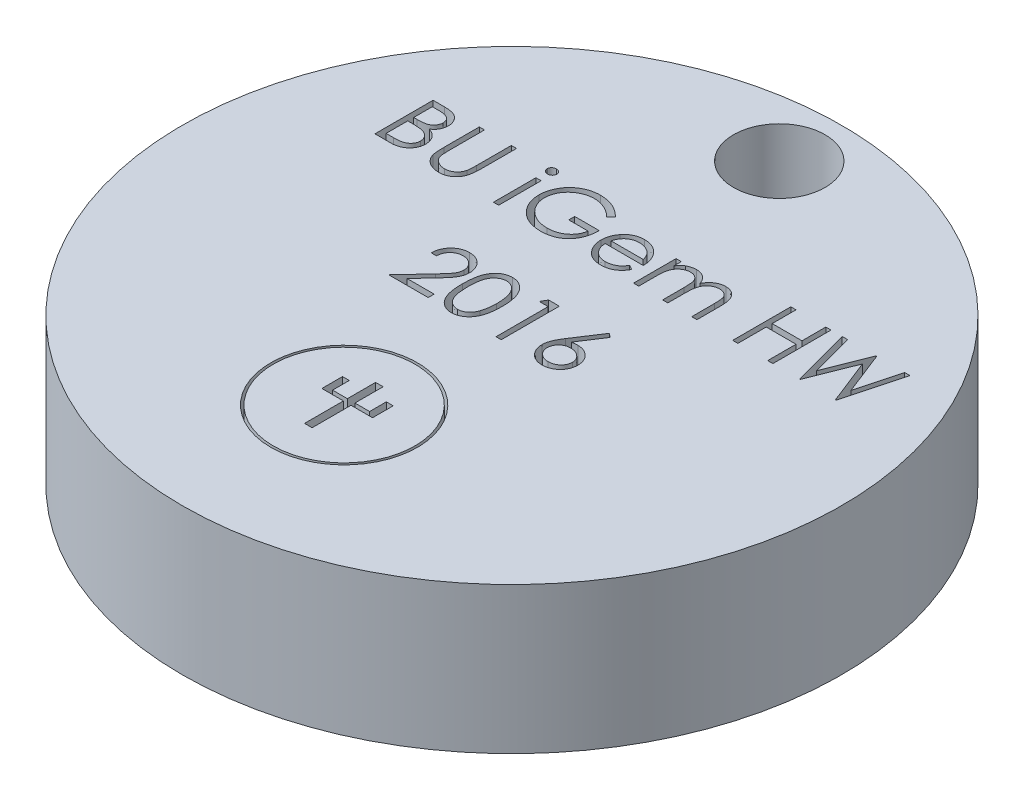
from build123d import *

# Parameters (mm, degrees)
SKETCH1_R           = 18
BOSS_EXTRUDE1_DEPTH = 8
SKETCH2_W           = 0.284935898
SKETCH2_H           = 2.320192307
CUT_EXTRUDE1_DEPTH  = 3
SKETCH3_R           = 4.004333154
SKETCH3_R_2         = 3.869636841
CUT_EXTRUDE2_DEPTH  = 3
SKETCH4_R           = 2.5
CUT_EXTRUDE3_DEPTH  = 27.683328263


with BuildPart() as part:
    # Sketch1 → Boss-Extrude1 (new body)
    with BuildSketch(Plane(origin=(0, 0, 0), x_dir=(1, 0, 0), z_dir=(0, 1, 0))):
        Circle(SKETCH1_R)
    extrude(amount=BOSS_EXTRUDE1_DEPTH)

    # Sketch2 → Cut-Extrude1 (cut)
    # profile 1 of 13: a face of its own
    with BuildSketch(Plane(origin=(0, 8, 0), x_dir=(1, 0, 0), z_dir=(0, 1, 0))):
        with BuildLine():
            Line((-12.333201326, 8.026096186), (-11.713720157, 8.026096186))
            add(Edge.make_bspline(
                [(-11.713720157, 8.026096186), (-11.683395751, 8.025936755), (-11.624619507, 8.025627738), (-11.539149013, 8.020835184), (-11.459094735, 8.014300426), (-11.384433456, 8.003931699), (-11.315199676, 7.991420587), (-11.251184748, 7.976269654), (-11.192592234, 7.958102654), (-11.122639966, 7.929213528), (-11.042883367, 7.886284654), (-10.956524825, 7.822849455), (-10.882679551, 7.745259292), (-10.819010534, 7.657735741), (-10.768390947, 7.561455433), (-10.731770227, 7.458713169), (-10.708585583, 7.35083416), (-10.706201218, 7.276772135), (-10.704996198, 7.239342379)],
                knots=[0, 0, 0, 0, 1.001505555, 1.941167018, 2.826882275, 3.653841531, 4.429895133, 5.150066043, 5.825578002, 6.45369114, 7.647487171, 8.808567382, 9.977351308, 11.170798116, 12.373658725, 13.556498008, 14.765093433, 16, 16, 16, 16], degree=3))
            add(Edge.make_bspline(
                [(-10.704996198, 7.239342379), (-10.705987904, 7.20427899), (-10.707936698, 7.135376122), (-10.726571915, 7.034597894), (-10.755746236, 6.938666432), (-10.796300283, 6.847931839), (-10.849007094, 6.764444204), (-10.911471426, 6.687530042), (-10.986833954, 6.620445868), (-11.043297465, 6.58294195), (-11.07197837, 6.563891658)],
                knots=[0, 0, 0, 0, 1.044552857, 2.05264487, 3.044412934, 4.028983338, 5.005914585, 5.980388656, 6.974128949, 8, 8, 8, 8], degree=3))
            add(Edge.make_bspline(
                [(-11.07197837, 6.563891658), (-11.035909982, 6.550044124), (-10.966902221, 6.523550359), (-10.871937053, 6.476709617), (-10.790117443, 6.42576256), (-10.720814318, 6.37012581), (-10.661543731, 6.310155674), (-10.609788562, 6.244972821), (-10.565627602, 6.173726948), (-10.527788021, 6.097160883), (-10.498261649, 6.016056444), (-10.476149222, 5.931174383), (-10.46347875, 5.842819072), (-10.461675676, 5.782688764), (-10.460765429, 5.752333165)],
                knots=[0, 0, 0, 0, 1.27268992, 2.434971085, 3.483601985, 4.442670788, 5.356604649, 6.2567628, 7.179492994, 8.113709626, 9.066344395, 10.018646069, 10.999752585, 12, 12, 12, 12], degree=3))
            add(Edge.make_bspline(
                [(-10.460765429, 5.752333165), (-10.461651568, 5.721338931), (-10.463395071, 5.660356907), (-10.476258331, 5.570771892), (-10.498038021, 5.485160333), (-10.528038275, 5.402968489), (-10.567192661, 5.324355367), (-10.614843028, 5.249231906), (-10.671658804, 5.178352906), (-10.735215835, 5.110930762), (-10.807117924, 5.050308412), (-10.88469293, 4.996319164), (-10.968917806, 4.951918094), (-11.058409258, 4.914619988), (-11.154171173, 4.886129173), (-11.255773538, 4.866196909), (-11.363128727, 4.852766626), (-11.436797572, 4.851662447), (-11.474577528, 4.851096186)],
                knots=[0, 0, 0, 0, 0.978564426, 1.925352924, 2.850884081, 3.763762016, 4.682927383, 5.618979971, 6.567305752, 7.547517671, 8.540179244, 9.531824382, 10.526200242, 11.540722885, 12.589160233, 13.674978461, 14.80764778, 16, 16, 16, 16], degree=3))
            Line((-11.474577528, 4.851096186), (-12.333201326, 4.851096186))
            Line((-12.333201326, 4.851096186), (-12.333201326, 8.026096186))
        make_face()
        with BuildLine():
            Line((-12.048265429, 7.70045516), (-12.048265429, 6.682826955))
            Line((-12.048265429, 6.682826955), (-11.856824123, 6.682826955))
            add(Edge.make_bspline(
                [(-11.856824123, 6.682826955), (-11.828839859, 6.683189742), (-11.774768557, 6.683890721), (-11.696464079, 6.685898697), (-11.623779241, 6.691521208), (-11.556839507, 6.697142103), (-11.49575029, 6.706281193), (-11.44064693, 6.717159762), (-11.390664631, 6.728664969), (-11.333025186, 6.748231575), (-11.267644726, 6.77714918), (-11.197946124, 6.822027203), (-11.136501284, 6.875480009), (-11.084615264, 6.937157524), (-11.042150573, 7.00507185), (-11.012655988, 7.078139377), (-10.992655952, 7.154539068), (-10.990849348, 7.206988483), (-10.989932096, 7.233618221)],
                knots=[0, 0, 0, 0, 1.156816544, 2.235205308, 3.236616184, 4.169592532, 5.011045266, 5.787822928, 6.49130361, 7.128639758, 8.301311294, 9.436451833, 10.541879658, 11.654887649, 12.756523258, 13.837046038, 14.901820046, 16, 16, 16, 16], degree=3))
            add(Edge.make_bspline(
                [(-10.989932096, 7.233618221), (-10.990409416, 7.251240171), (-10.991345733, 7.28580755), (-10.999014086, 7.336198749), (-11.012047528, 7.383591296), (-11.028788209, 7.428634668), (-11.052182233, 7.469920418), (-11.079726232, 7.508876031), (-11.113005394, 7.544174881), (-11.150885242, 7.577167212), (-11.194435921, 7.606417605), (-11.24363145, 7.632036012), (-11.299137415, 7.652665145), (-11.360018362, 7.67073194), (-11.42721142, 7.683421321), (-11.499941193, 7.693992608), (-11.578803402, 7.699374453), (-11.633363603, 7.700086889), (-11.661566711, 7.70045516)],
                knots=[0, 0, 0, 0, 0.91205012, 1.789085906, 2.630437955, 3.453916878, 4.269457761, 5.079663411, 5.91843418, 6.774407191, 7.675494373, 8.627863946, 9.638891023, 10.736472738, 11.911756761, 13.175263542, 14.539845004, 16, 16, 16, 16], degree=3))
            Line((-11.661566711, 7.70045516), (-12.048265429, 7.70045516))
        make_face(mode=Mode.SUBTRACT)
        with BuildLine():
            Line((-12.048265429, 6.357185929), (-12.048265429, 5.176737211))
            Line((-12.048265429, 5.176737211), (-11.642486182, 5.176737211))
            add(Edge.make_bspline(
                [(-11.642486182, 5.176737211), (-11.613440442, 5.177085325), (-11.557458608, 5.177756268), (-11.476631063, 5.179946614), (-11.40171639, 5.184928893), (-11.333056439, 5.192771914), (-11.269909814, 5.201279507), (-11.21303404, 5.21271974), (-11.161968072, 5.225827011), (-11.10275495, 5.246087296), (-11.036076768, 5.277561952), (-10.964221205, 5.325018429), (-10.900334564, 5.381554572), (-10.846082651, 5.446987616), (-10.801620868, 5.518136034), (-10.769276277, 5.593560744), (-10.749327428, 5.672015473), (-10.74691246, 5.725506705), (-10.745701326, 5.752333165)],
                knots=[0, 0, 0, 0, 1.160039823, 2.235823828, 3.228722157, 4.157150951, 4.99529583, 5.772374946, 6.472645482, 7.099169577, 8.269452708, 9.405989375, 10.527446681, 11.663510218, 12.788923519, 13.866172445, 14.929861265, 16, 16, 16, 16], degree=3))
            add(Edge.make_bspline(
                [(-10.745701326, 5.752333165), (-10.745951792, 5.769109266), (-10.746448685, 5.80239087), (-10.753942242, 5.85130022), (-10.764840539, 5.898676548), (-10.778929768, 5.944648498), (-10.799448856, 5.988384918), (-10.823403365, 6.030750812), (-10.851489779, 6.071802182), (-10.895254129, 6.123701869), (-10.958910144, 6.183498017), (-11.049358433, 6.242042751), (-11.152203303, 6.289257547), (-11.226795386, 6.30930493), (-11.265327729, 6.319660889)],
                knots=[0, 0, 0, 0, 0.723448775, 1.435228256, 2.130040452, 2.821711965, 3.505591119, 4.210454504, 4.921174351, 5.648778258, 7.137944449, 8.670945889, 10.280296675, 12, 12, 12, 12], degree=3))
            add(Edge.make_bspline(
                [(-11.265327729, 6.319660889), (-11.280775551, 6.322795144), (-11.314269617, 6.329590855), (-11.368886494, 6.336764271), (-11.431239746, 6.343155147), (-11.501473356, 6.347882411), (-11.579676184, 6.352768776), (-11.666015246, 6.354669078), (-11.760137952, 6.356936264), (-11.825445319, 6.357100578), (-11.859368193, 6.357185929)],
                knots=[0, 0, 0, 0, 0.634451884, 1.375622551, 2.216452059, 3.157844607, 4.20941857, 5.370758133, 6.634282058, 8, 8, 8, 8], degree=3))
            Line((-11.859368193, 6.357185929), (-12.048265429, 6.357185929))
        make_face(mode=Mode.SUBTRACT)
    # profile 2 of 13: a face of its own
    with BuildSketch(Plane(origin=(0, 8, 0), x_dir=(1, 0, 0), z_dir=(0, 1, 0))):
        with BuildLine():
            Line((-9.809483378, 8.026096186), (-9.52454748, 8.026096186))
            Line((-9.52454748, 8.026096186), (-9.52454748, 6.12376746))
            add(Edge.make_bspline(
                [(-9.52454748, 6.12376746), (-9.524589884, 6.096842792), (-9.524670352, 6.045748596), (-9.524132857, 5.973024495), (-9.522627573, 5.908370192), (-9.521678556, 5.85153647), (-9.519567332, 5.802784121), (-9.517845533, 5.761849017), (-9.515631599, 5.728924991), (-9.512970843, 5.709710865), (-9.511827128, 5.701451754)],
                knots=[0, 0, 0, 0, 1.528628734, 2.90083645, 4.128790002, 5.200304208, 6.127813768, 6.898992206, 7.526736466, 8, 8, 8, 8], degree=3))
            add(Edge.make_bspline(
                [(-9.511827128, 5.701451754), (-9.507130433, 5.671655048), (-9.498001685, 5.613740572), (-9.474736757, 5.531273773), (-9.442245167, 5.456950236), (-9.403743264, 5.388450708), (-9.353004395, 5.327681788), (-9.292222616, 5.271700503), (-9.218582783, 5.222740366), (-9.13670352, 5.17797213), (-9.048451911, 5.141990234), (-8.958271691, 5.114781968), (-8.867518417, 5.098200394), (-8.806761468, 5.096280391), (-8.776590749, 5.095326955)],
                knots=[0, 0, 0, 0, 1.035780045, 2.013197591, 2.933192213, 3.817615948, 4.702609284, 5.640816605, 6.646850145, 7.73207398, 8.84249596, 9.914020372, 10.964143139, 12, 12, 12, 12], degree=3))
            add(Edge.make_bspline(
                [(-8.776590749, 5.095326955), (-8.750688428, 5.09630109), (-8.69903339, 5.098243735), (-8.62228327, 5.110273748), (-8.5475346, 5.131954975), (-8.474418269, 5.159931042), (-8.405882733, 5.196894928), (-8.341889754, 5.239594904), (-8.284772471, 5.289679056), (-8.232649858, 5.345105797), (-8.187261024, 5.407644044), (-8.147917202, 5.475932069), (-8.115690109, 5.550997548), (-8.099775626, 5.603751917), (-8.091599764, 5.630853798)],
                knots=[0, 0, 0, 0, 0.994687771, 1.983630487, 2.973142513, 3.978332533, 4.983357753, 5.956394766, 6.925816176, 7.893390482, 8.871859704, 9.88551698, 10.913711441, 12, 12, 12, 12], degree=3))
            add(Edge.make_bspline(
                [(-8.091599764, 5.630853798), (-8.088878222, 5.642055719), (-8.082813529, 5.667018113), (-8.077146567, 5.70921957), (-8.071244219, 5.759012064), (-8.067148859, 5.816753351), (-8.063156323, 5.882249948), (-8.06076775, 5.955843053), (-8.059663727, 6.037265439), (-8.059334724, 6.094086293), (-8.059162865, 6.12376746)],
                knots=[0, 0, 0, 0, 0.558680831, 1.244966039, 2.062412453, 2.990489873, 4.051219941, 5.244515665, 6.560634259, 8, 8, 8, 8], degree=3))
            Line((-8.059162865, 6.12376746), (-8.059162865, 8.026096186))
            Line((-8.059162865, 8.026096186), (-7.774226967, 8.026096186))
            Line((-7.774226967, 8.026096186), (-7.774226967, 6.108503036))
            add(Edge.make_bspline(
                [(-7.774226967, 6.108503036), (-7.774457491, 6.073942364), (-7.774907372, 6.006495111), (-7.778808609, 5.907660664), (-7.785028887, 5.813904745), (-7.793817367, 5.725214752), (-7.805462363, 5.64190805), (-7.818412027, 5.563254439), (-7.834903461, 5.48981851), (-7.854165189, 5.421027674), (-7.876184765, 5.355545101), (-7.904706378, 5.293398001), (-7.93684146, 5.232697081), (-7.974954752, 5.174360439), (-8.017782221, 5.11812978), (-8.066270531, 5.064346119), (-8.11881602, 5.012149985), (-8.176292192, 4.962880275), (-8.237751597, 4.917696689), (-8.303011416, 4.877965854), (-8.371570342, 4.844380144), (-8.443250164, 4.816734127), (-8.518081469, 4.795947312), (-8.596066146, 4.780457706), (-8.6773817, 4.771656336), (-8.732685352, 4.7703483), (-8.760690309, 4.769685929)],
                knots=[0, 0, 0, 0, 1.316592851, 2.569410997, 3.76748051, 4.895814652, 5.963796859, 6.97159953, 7.931736103, 8.829262218, 9.692595152, 10.560224239, 11.431080259, 12.30701507, 13.211635791, 14.121146779, 15.063487852, 16.031507147, 17.00238618, 17.966455255, 18.938106653, 19.907068911, 20.888905087, 21.893141452, 22.933117798, 24, 24, 24, 24], degree=3))
            add(Edge.make_bspline(
                [(-8.760690309, 4.769685929), (-8.791232995, 4.770397823), (-8.851157635, 4.771794557), (-8.939457168, 4.779798052), (-9.024106474, 4.79487331), (-9.105999591, 4.814068401), (-9.184021585, 4.84054222), (-9.259217781, 4.871474091), (-9.330300299, 4.909462748), (-9.398422309, 4.951729612), (-9.461763337, 4.999286248), (-9.519908839, 5.051120549), (-9.572954807, 5.106402177), (-9.620007125, 5.165729651), (-9.661845356, 5.228641557), (-9.697886335, 5.295315867), (-9.728831921, 5.365726768), (-9.744803592, 5.414670029), (-9.752877809, 5.439412492)],
                knots=[0, 0, 0, 0, 1.13879206, 2.234305948, 3.301075583, 4.341971843, 5.366689343, 6.369221514, 7.369726634, 8.367512178, 9.355451585, 10.318319045, 11.268648973, 12.207971039, 13.137398894, 14.081662264, 15.030215811, 16, 16, 16, 16], degree=3))
            add(Edge.make_bspline(
                [(-9.752877809, 5.439412492), (-9.757574231, 5.456314898), (-9.767760875, 5.492976595), (-9.778669538, 5.553652196), (-9.787839919, 5.623515728), (-9.796462818, 5.702571975), (-9.801550944, 5.790882211), (-9.806011764, 5.888408156), (-9.809514804, 5.995267735), (-9.809494146, 6.069702903), (-9.809483378, 6.108503036)],
                knots=[0, 0, 0, 0, 0.625038921, 1.35572334, 2.194682327, 3.136881307, 4.189498639, 5.346923369, 6.617055217, 8, 8, 8, 8], degree=3))
            Line((-9.809483378, 6.108503036), (-9.809483378, 8.026096186))
        make_face()
    # profile 3 of 13: a face of its own
    with BuildSketch(Plane(origin=(0, 8, 0), x_dir=(1, 0, 0), z_dir=(0, 1, 0))):
        with BuildLine():
            add(Edge.make_bspline(
                [(-5.719890028, 8.14821157), (-5.70220862, 8.147391375), (-5.667585028, 8.145785275), (-5.617516849, 8.132031649), (-5.57192656, 8.108718363), (-5.531488188, 8.077440367), (-5.496788262, 8.040656229), (-5.472494332, 7.997783779), (-5.45688023, 7.951466299), (-5.454994683, 7.919158326), (-5.45403466, 7.902708766)],
                knots=[0, 0, 0, 0, 1.055194115, 2.066272739, 3.074728998, 4.095836921, 5.109056067, 6.073838105, 7.019297344, 8, 8, 8, 8], degree=3))
            add(Edge.make_bspline(
                [(-5.45403466, 7.902708766), (-5.455016333, 7.886686216), (-5.456956986, 7.855011532), (-5.472482272, 7.809497025), (-5.496995302, 7.767220282), (-5.531465937, 7.730507566), (-5.571932456, 7.699246861), (-5.617515283, 7.675928991), (-5.66758544, 7.66217658), (-5.70220876, 7.660570313), (-5.719890028, 7.659750032)],
                knots=[0, 0, 0, 0, 0.96129708, 1.900370562, 2.859976407, 3.87933698, 4.906634145, 5.921202961, 6.938410037, 8, 8, 8, 8], degree=3))
            add(Edge.make_bspline(
                [(-5.719890028, 7.659750032), (-5.737369107, 7.660538992), (-5.771389849, 7.662074601), (-5.820708341, 7.676198831), (-5.865909899, 7.69925484), (-5.906427138, 7.73030288), (-5.940200242, 7.767445751), (-5.964782294, 7.809471224), (-5.980271724, 7.8550181), (-5.982217209, 7.886688423), (-5.983201326, 7.902708766)],
                knots=[0, 0, 0, 0, 1.054934014, 2.053291228, 3.073705704, 4.106921865, 5.123545215, 6.088680038, 7.033164197, 8, 8, 8, 8], degree=3))
            add(Edge.make_bspline(
                [(-5.983201326, 7.902708766), (-5.982238769, 7.919156036), (-5.980348246, 7.951459514), (-5.964770684, 7.997810008), (-5.940405001, 8.040428942), (-5.906404776, 8.07764493), (-5.865915851, 8.108710432), (-5.820706803, 8.131761822), (-5.771390255, 8.145887252), (-5.737369244, 8.147422695), (-5.719890028, 8.14821157)],
                knots=[0, 0, 0, 0, 0.98631895, 1.937192651, 2.907499808, 3.917963147, 4.944918757, 5.95915025, 6.951458133, 8, 8, 8, 8], degree=3))
        make_face()
    # profile 4 of 13: a face of its own
    with BuildSketch(Plane(origin=(0, 8, 0), x_dir=(1, 0, 0), z_dir=(0, 1, 0))):
        with Locations((-5.718617993, 6.01119234)):
            Rectangle(SKETCH2_W, SKETCH2_H)
    # profile 5 of 13: a face of its own
    with BuildSketch(Plane(origin=(0, 8, 0), x_dir=(1, 0, 0), z_dir=(0, 1, 0))):
        with BuildLine():
            Line((-1.831278249, 7.484209166), (-2.075509019, 7.25269875))
            add(Edge.make_bspline(
                [(-2.075509019, 7.25269875), (-2.11970401, 7.29427389), (-2.207040138, 7.376432787), (-2.349425501, 7.483032047), (-2.497982512, 7.57435058), (-2.651935991, 7.648651238), (-2.807473394, 7.707935528), (-2.962530212, 7.750143198), (-3.115515955, 7.777060428), (-3.217267646, 7.780279306), (-3.267406054, 7.781865416)],
                knots=[0, 0, 0, 0, 1.08915593, 2.152340314, 3.188132944, 4.216796309, 5.218260357, 6.173443236, 7.099959455, 8, 8, 8, 8], degree=3))
            add(Edge.make_bspline(
                [(-3.267406054, 7.781865416), (-3.298171532, 7.781490217), (-3.359622696, 7.78074079), (-3.450901174, 7.771175681), (-3.541222337, 7.757418983), (-3.630415684, 7.737514565), (-3.718654637, 7.712287776), (-3.805632303, 7.680732391), (-3.891510932, 7.643942991), (-3.975481592, 7.601432033), (-4.056889048, 7.554732458), (-4.133775606, 7.502981281), (-4.206631333, 7.447837165), (-4.274086861, 7.387919491), (-4.336530209, 7.323771006), (-4.395447661, 7.256585007), (-4.448767065, 7.184525915), (-4.496928336, 7.108919526), (-4.53989209, 7.031093754), (-4.577818511, 6.951797685), (-4.609656584, 6.871294332), (-4.634847447, 6.789482675), (-4.655630683, 6.70699564), (-4.670251655, 6.623262072), (-4.67849461, 6.538192315), (-4.679920439, 6.481226231), (-4.680637224, 6.452588573)],
                knots=[0, 0, 0, 0, 1.02818874, 2.053710826, 3.065248034, 4.081641283, 5.106893873, 6.131558223, 7.173050175, 8.228653731, 9.27666206, 10.308777013, 11.325269123, 12.329503258, 13.32196095, 14.316845687, 15.314881793, 16.315733098, 17.311955233, 18.285320748, 19.252783886, 20.203351036, 21.145449891, 22.095197417, 23.042428769, 24, 24, 24, 24], degree=3))
            add(Edge.make_bspline(
                [(-4.680637224, 6.452588573), (-4.679951679, 6.423314332), (-4.678582463, 6.364845788), (-4.669819173, 6.277584022), (-4.653555697, 6.191618264), (-4.631813562, 6.106666029), (-4.604616679, 6.022581825), (-4.570714332, 5.939730191), (-4.530559108, 5.858114194), (-4.484080236, 5.778469213), (-4.433111323, 5.700887613), (-4.376012957, 5.627808618), (-4.315360856, 5.558259084), (-4.24894539, 5.493783213), (-4.178896233, 5.432656393), (-4.103120526, 5.376562741), (-4.023108294, 5.324421781), (-3.938737466, 5.276890653), (-3.850923513, 5.234428624), (-3.760883459, 5.196669804), (-3.668329655, 5.165573548), (-3.5737485, 5.140229696), (-3.477252747, 5.119455855), (-3.378352583, 5.106091391), (-3.277775198, 5.09639328), (-3.209976581, 5.095684194), (-3.175819516, 5.095326955)],
                knots=[0, 0, 0, 0, 0.93586088, 1.869166235, 2.799637598, 3.729985548, 4.670839027, 5.622275134, 6.589130586, 7.576015415, 8.568469353, 9.55398029, 10.53834874, 11.515998671, 12.510579167, 13.508179873, 14.527009472, 15.561807829, 16.601455013, 17.643573243, 18.680854198, 19.719860599, 20.772568776, 21.833555941, 22.908541556, 24, 24, 24, 24], degree=3))
            add(Edge.make_bspline(
                [(-3.175819516, 5.095326955), (-3.134654872, 5.096187449), (-3.053821406, 5.097877169), (-2.934997991, 5.111031003), (-2.820876634, 5.13157488), (-2.711778006, 5.161661087), (-2.607575395, 5.200036563), (-2.507886798, 5.246296664), (-2.413497079, 5.302215724), (-2.324122486, 5.365329161), (-2.241792753, 5.435646188), (-2.167539369, 5.511523658), (-2.102546675, 5.592593261), (-2.045845984, 5.678377511), (-1.998938848, 5.769586467), (-1.960437169, 5.865773148), (-1.930924826, 5.96698082), (-1.918809956, 6.036913943), (-1.912688506, 6.072250032)],
                knots=[0, 0, 0, 0, 1.13008108, 2.219097802, 3.278683437, 4.311054135, 5.322181354, 6.324827112, 7.324222904, 8.330512327, 9.32562643, 10.293043162, 11.24128371, 12.174520618, 13.111833804, 14.052305215, 15.015860969, 16, 16, 16, 16], degree=3))
            Line((-1.912688506, 6.072250032), (-2.971021839, 6.072250032))
            Line((-2.971021839, 6.072250032), (-2.971021839, 6.397891057))
            Line((-2.971021839, 6.397891057), (-1.627752608, 6.397891057))
            add(Edge.make_bspline(
                [(-1.627752608, 6.397891057), (-1.629300057, 6.337196407), (-1.632328692, 6.218406012), (-1.653572994, 6.045168695), (-1.687877973, 5.881545801), (-1.734741256, 5.727365015), (-1.795406689, 5.582844827), (-1.869223197, 5.447838506), (-1.957372193, 5.323218231), (-2.056713807, 5.207966635), (-2.168201626, 5.10516085), (-2.28882316, 5.014804034), (-2.418777696, 4.938692376), (-2.557942307, 4.876770204), (-2.705861414, 4.82844308), (-2.862877302, 4.794178864), (-3.028777039, 4.773650254), (-3.14247531, 4.77102736), (-3.200624203, 4.769685929)],
                knots=[0, 0, 0, 0, 1.140356446, 2.231883559, 3.274166699, 4.278491846, 5.25512956, 6.21435461, 7.1637429, 8.11826594, 9.068280886, 10.0076534, 10.945064095, 11.891975133, 12.864533718, 13.863980011, 14.907571808, 16, 16, 16, 16], degree=3))
            add(Edge.make_bspline(
                [(-3.200624203, 4.769685929), (-3.23646554, 4.770202203), (-3.307156208, 4.771220463), (-3.411560122, 4.778457056), (-3.513085392, 4.789597293), (-3.611717228, 4.80642037), (-3.707818439, 4.827025806), (-3.800909062, 4.853411615), (-3.891343714, 4.883953935), (-3.979262172, 4.918693582), (-4.06386644, 4.958945013), (-4.145533352, 5.003675901), (-4.224714337, 5.052655592), (-4.300870037, 5.106731145), (-4.374397251, 5.165498091), (-4.444821874, 5.229074218), (-4.512538164, 5.297265162), (-4.554956584, 5.345687549), (-4.576330333, 5.37008657)],
                knots=[0, 0, 0, 0, 1.107784379, 2.184907829, 3.233506516, 4.263428166, 5.276301166, 6.270063455, 7.25232949, 8.225834625, 9.190232166, 10.146266622, 11.1027726, 12.066435141, 13.031522626, 14.010570082, 14.99756817, 16, 16, 16, 16], degree=3))
            add(Edge.make_bspline(
                [(-4.576330333, 5.37008657), (-4.607341857, 5.408794948), (-4.668850145, 5.485569185), (-4.748023902, 5.608577706), (-4.815516603, 5.735942251), (-4.870278842, 5.868017378), (-4.91303982, 6.00467955), (-4.943706921, 6.145754135), (-4.961674961, 6.2914228), (-4.964263528, 6.389997719), (-4.965573121, 6.439868221)],
                knots=[0, 0, 0, 0, 1.023165419, 2.029347347, 3.013907458, 3.994755782, 4.975994455, 5.96558838, 6.970761222, 8, 8, 8, 8], degree=3))
            add(Edge.make_bspline(
                [(-4.965573121, 6.439868221), (-4.965090305, 6.477211893), (-4.96413081, 6.551424622), (-4.952496234, 6.661603751), (-4.935803519, 6.769826521), (-4.911267977, 6.876004469), (-4.880337794, 6.980208506), (-4.841735703, 7.082487016), (-4.796791404, 7.182900356), (-4.744553133, 7.280757365), (-4.686419373, 7.374759511), (-4.623327388, 7.464528376), (-4.554381265, 7.54842917), (-4.480706932, 7.627524451), (-4.401425377, 7.700820548), (-4.317279328, 7.768996063), (-4.228203939, 7.832142446), (-4.133918975, 7.889265081), (-4.035831719, 7.940576366), (-3.934177289, 7.985560865), (-3.828986717, 8.022738587), (-3.721048076, 8.054283373), (-3.609544344, 8.077610679), (-3.495284678, 8.094527755), (-3.377673505, 8.106103442), (-3.298175107, 8.107034402), (-3.25786579, 8.107506442)],
                knots=[0, 0, 0, 0, 1.008945113, 2.00506715, 2.99143336, 3.967273523, 4.948097931, 5.927297278, 6.919902385, 7.919676788, 8.923139349, 9.905703106, 10.883022732, 11.856032218, 12.825136022, 13.798837087, 14.781400844, 15.773989409, 16.776158564, 17.77167057, 18.775803737, 19.789618931, 20.80898985, 21.851988756, 22.910860228, 24, 24, 24, 24], degree=3))
            add(Edge.make_bspline(
                [(-3.25786579, 8.107506442), (-3.224992526, 8.10698076), (-3.159808706, 8.105938395), (-3.062811792, 8.098713321), (-2.967314129, 8.087261658), (-2.873174118, 8.071634501), (-2.780712343, 8.050349582), (-2.689665403, 8.024878567), (-2.599901317, 7.995222413), (-2.511701405, 7.95985396), (-2.42447262, 7.9197096), (-2.33772995, 7.87452171), (-2.251769777, 7.823517598), (-2.166443029, 7.76654582), (-2.081211644, 7.704584862), (-1.997423718, 7.635862601), (-1.913056762, 7.563089101), (-1.858807973, 7.51076312), (-1.831278249, 7.484209166)],
                knots=[0, 0, 0, 0, 0.985871117, 1.954866573, 2.915460327, 3.869826059, 4.81536089, 5.759505086, 6.70452669, 7.649098992, 8.607881297, 9.583363685, 10.581137262, 11.603961102, 12.659522466, 13.73993555, 14.853081303, 16, 16, 16, 16], degree=3))
        make_face()
    # profile 6 of 13: a face of its own
    with BuildSketch(Plane(origin=(0, 8, 0), x_dir=(1, 0, 0), z_dir=(0, 1, 0))):
        with BuildLine():
            Line((0.846355965, 5.583788493), (1.099490981, 5.450860809))
            add(Edge.make_bspline(
                [(1.099490981, 5.450860809), (1.079319213, 5.415080073), (1.040072939, 5.345464929), (0.972580832, 5.24982317), (0.901830881, 5.163782742), (0.824629424, 5.08964227), (0.743286215, 5.025007085), (0.657350164, 4.968457773), (0.56637388, 4.920271687), (0.470353058, 4.879674751), (0.368481322, 4.848460424), (0.260511804, 4.826413023), (0.146237661, 4.812784773), (0.067909341, 4.811201681), (0.027801278, 4.810391057)],
                knots=[0, 0, 0, 0, 1.120438281, 2.179929193, 3.190490725, 4.156257408, 5.095198341, 6.022838206, 6.959905092, 7.901321166, 8.864066838, 9.862729781, 10.905609505, 12, 12, 12, 12], degree=3))
            add(Edge.make_bspline(
                [(0.027801278, 4.810391057), (-0.016777516, 4.811431709), (-0.103737829, 4.81346172), (-0.230320313, 4.830962741), (-0.349500214, 4.859512666), (-0.461270831, 4.899395693), (-0.565358446, 4.95149048), (-0.661969936, 5.014953724), (-0.751613363, 5.089459412), (-0.831463895, 5.175652901), (-0.903349417, 5.267892962), (-0.966782125, 5.364010086), (-1.019811367, 5.463762439), (-1.062948377, 5.566514986), (-1.097787076, 5.671620089), (-1.1220683, 5.780034064), (-1.136065286, 5.891463486), (-1.138210176, 5.966844641), (-1.13929107, 6.004832163)],
                knots=[0, 0, 0, 0, 1.145258523, 2.234067595, 3.276747158, 4.290159414, 5.277019952, 6.260822364, 7.254936242, 8.264827045, 9.274100331, 10.257902744, 11.220704747, 12.172965371, 13.118907548, 14.062713208, 15.023725156, 16, 16, 16, 16], degree=3))
            add(Edge.make_bspline(
                [(-1.13929107, 6.004832163), (-1.138330278, 6.040478188), (-1.136426114, 6.111123902), (-1.124423899, 6.215686217), (-1.103152948, 6.317312027), (-1.073964425, 6.416085777), (-1.036271509, 6.511842084), (-0.990159425, 6.604639227), (-0.935556339, 6.694378461), (-0.893398985, 6.750987018), (-0.872163666, 6.779501634)],
                knots=[0, 0, 0, 0, 1.024358464, 2.0301432, 3.019427413, 4.004406732, 4.986367066, 5.972626655, 6.978780325, 8, 8, 8, 8], degree=3))
            add(Edge.make_bspline(
                [(-0.872163666, 6.779501634), (-0.843400268, 6.813854109), (-0.786784624, 6.88147086), (-0.69102993, 6.970314913), (-0.587343323, 7.044740337), (-0.477024205, 7.106432525), (-0.358790404, 7.153307905), (-0.234231261, 7.188239783), (-0.10192848, 7.207814122), (-0.011481601, 7.210578942), (0.034797472, 7.211993621)],
                knots=[0, 0, 0, 0, 1.030682036, 2.02871468, 2.997146059, 3.962720338, 4.930598197, 5.918074684, 6.934738563, 8, 8, 8, 8], degree=3))
            add(Edge.make_bspline(
                [(0.034797472, 7.211993621), (0.082374942, 7.210765306), (0.175711094, 7.20835563), (0.311811661, 7.186016028), (0.440590311, 7.150589782), (0.561995511, 7.100557415), (0.676039571, 7.036005535), (0.781981201, 6.956048294), (0.881632216, 6.863140457), (0.939606427, 6.791690974), (0.969107368, 6.755332964)],
                knots=[0, 0, 0, 0, 1.056321875, 2.072262726, 3.055038591, 4.01806755, 4.982017516, 5.957941055, 6.960871419, 8, 8, 8, 8], degree=3))
            add(Edge.make_bspline(
                [(0.969107368, 6.755332964), (0.989179662, 6.727934001), (1.029190642, 6.673318451), (1.079307655, 6.584263187), (1.122811863, 6.491090005), (1.157585335, 6.392292807), (1.185742596, 6.289042188), (1.206114139, 6.180600022), (1.218060865, 6.066998602), (1.220409183, 5.989595227), (1.221606366, 5.950134647)],
                knots=[0, 0, 0, 0, 0.94817472, 1.890038105, 2.849395472, 3.817997239, 4.812318967, 5.836947057, 6.897266129, 8, 8, 8, 8], degree=3))
            Line((1.221606366, 5.950134647), (-0.854355173, 5.950134647))
            add(Edge.make_bspline(
                [(-0.854355173, 5.950134647), (-0.85295853, 5.919563512), (-0.850212088, 5.859446607), (-0.837407636, 5.771480254), (-0.81722482, 5.687684436), (-0.788859313, 5.608687677), (-0.754508675, 5.533458204), (-0.712430203, 5.46255407), (-0.662229322, 5.396298234), (-0.606235295, 5.334098045), (-0.543908144, 5.278707211), (-0.478337366, 5.229130243), (-0.408583918, 5.187578023), (-0.335197799, 5.153850551), (-0.25829768, 5.127446965), (-0.177859332, 5.109424013), (-0.09404104, 5.097352566), (-0.036903982, 5.096010298), (-0.007815709, 5.095326955)],
                knots=[0, 0, 0, 0, 1.094153842, 2.151609401, 3.174256925, 4.172055639, 5.149267565, 6.128595816, 7.11444997, 8.118368179, 9.117203808, 10.09244225, 11.054858984, 12.015122123, 12.976791628, 13.957293641, 14.960065497, 16, 16, 16, 16], degree=3))
            add(Edge.make_bspline(
                [(-0.007815709, 5.095326955), (0.02062426, 5.095878549), (0.077054616, 5.096973018), (0.161093108, 5.107615537), (0.243769679, 5.124824287), (0.324742142, 5.148310207), (0.402367124, 5.176954922), (0.474254159, 5.211519658), (0.540366926, 5.249755499), (0.602158745, 5.293488562), (0.662094575, 5.347017417), (0.721550973, 5.413815535), (0.785301937, 5.492816364), (0.825206782, 5.552275647), (0.846355965, 5.583788493)],
                knots=[0, 0, 0, 0, 0.99110716, 1.966546729, 2.947904876, 3.932708344, 4.903319531, 5.828989031, 6.710028674, 7.56322171, 8.463672341, 9.504779593, 10.677557249, 12, 12, 12, 12], degree=3))
        make_face()
        with BuildLine():
            add(Edge.make_bspline(
                [(0.936670468, 6.235070545), (0.926241388, 6.272864723), (0.906168764, 6.34560635), (0.864225776, 6.446336301), (0.81698945, 6.535860325), (0.761089737, 6.613493278), (0.697754178, 6.682439322), (0.624597477, 6.742690467), (0.542559202, 6.796590583), (0.45206341, 6.842086065), (0.35623122, 6.880811865), (0.255895603, 6.906778935), (0.153517466, 6.924567591), (0.084271364, 6.926224132), (0.049425877, 6.927057724)],
                knots=[0, 0, 0, 0, 1.154881502, 2.222775134, 3.210006277, 4.132804581, 5.035138423, 5.962687519, 6.919655026, 7.923214229, 8.944639381, 9.960483929, 10.97369054, 12, 12, 12, 12], degree=3))
            add(Edge.make_bspline(
                [(0.049425877, 6.927057724), (0.020987458, 6.926502851), (-0.035229318, 6.925405982), (-0.11805243, 6.915000936), (-0.197590442, 6.897801649), (-0.274430239, 6.874247724), (-0.347564884, 6.842852777), (-0.418498709, 6.806037993), (-0.485428069, 6.761096699), (-0.527284815, 6.726844024), (-0.548430693, 6.709539695)],
                knots=[0, 0, 0, 0, 1.04873581, 2.073130211, 3.073294108, 4.04793562, 5.032784715, 6.005352987, 6.992311501, 8, 8, 8, 8], degree=3))
            add(Edge.make_bspline(
                [(-0.548430693, 6.709539695), (-0.563573885, 6.695846995), (-0.594220014, 6.668136306), (-0.635168915, 6.620394097), (-0.674376059, 6.568912323), (-0.710057301, 6.511721388), (-0.742784826, 6.449472539), (-0.773409948, 6.382690827), (-0.800974764, 6.310869487), (-0.816483378, 6.260820203), (-0.824462344, 6.235070545)],
                knots=[0, 0, 0, 0, 0.879870761, 1.780643979, 2.707998968, 3.669668524, 4.684282772, 5.740141944, 6.837334558, 8, 8, 8, 8], degree=3))
            Line((-0.824462344, 6.235070545), (0.936670468, 6.235070545))
        make_face(mode=Mode.SUBTRACT)
    # profile 7 of 13: a face of its own
    with BuildSketch(Plane(origin=(0, 8, 0), x_dir=(1, 0, 0), z_dir=(0, 1, 0))):
        with BuildLine():
            Line((1.791478161, 7.171288493), (2.076414058, 7.171288493))
            Line((2.076414058, 7.171288493), (2.076414058, 6.768053317))
            add(Edge.make_bspline(
                [(2.076414058, 6.768053317), (2.102071641, 6.803329927), (2.15123403, 6.870923294), (2.231847872, 6.959995909), (2.312380489, 7.035586449), (2.370377199, 7.075267483), (2.398238978, 7.09433036)],
                knots=[0, 0, 0, 0, 1.134379233, 2.173579362, 3.122582517, 4, 4, 4, 4], degree=3))
            add(Edge.make_bspline(
                [(2.398238978, 7.09433036), (2.436216207, 7.112478084), (2.511507159, 7.148456471), (2.63072317, 7.184954056), (2.752710906, 7.207383255), (2.835086929, 7.210450644), (2.876524234, 7.211993621)],
                knots=[0, 0, 0, 0, 1.014936303, 2.012140481, 3.000054389, 4, 4, 4, 4], degree=3))
            add(Edge.make_bspline(
                [(2.876524234, 7.211993621), (2.904548596, 7.211045393), (2.9600073, 7.209168901), (3.04218001, 7.196958726), (3.121880322, 7.175852984), (3.198637334, 7.146454911), (3.270955379, 7.110852559), (3.337257723, 7.069078896), (3.396788254, 7.022182263), (3.449516887, 6.968044945), (3.49693236, 6.905146745), (3.540546742, 6.831791319), (3.580846756, 6.746331513), (3.603181801, 6.684313293), (3.614940701, 6.651662091)],
                knots=[0, 0, 0, 0, 1.009824226, 1.998387844, 2.986035974, 3.974953746, 4.955485308, 5.885931332, 6.793869504, 7.679848016, 8.601185859, 9.625726857, 10.749998409, 12, 12, 12, 12], degree=3))
            add(Edge.make_bspline(
                [(3.614940701, 6.651662091), (3.627378765, 6.674090671), (3.651855127, 6.718226968), (3.692953812, 6.780691248), (3.736013885, 6.83911741), (3.781402318, 6.893551809), (3.828958907, 6.943725636), (3.878907463, 6.989804775), (3.930963658, 7.031987112), (4.003346618, 7.081265978), (4.097519484, 7.133609192), (4.216253702, 7.178992138), (4.339761358, 7.207037483), (4.423597413, 7.210330659), (4.465932287, 7.211993621)],
                knots=[0, 0, 0, 0, 0.86119277, 1.694706429, 2.50939023, 3.298075842, 4.073795165, 4.829715201, 5.57930267, 6.321991688, 7.768977793, 9.186738141, 10.579381044, 12, 12, 12, 12], degree=3))
            add(Edge.make_bspline(
                [(4.465932287, 7.211993621), (4.5048319, 7.210526571), (4.580962219, 7.207655411), (4.691794453, 7.18510976), (4.795155948, 7.146395038), (4.890838724, 7.09356881), (4.977162269, 7.027184837), (5.052197778, 6.948200963), (5.115489465, 6.857175869), (5.156835802, 6.77154885), (5.184880363, 6.695951799), (5.202171626, 6.631538949), (5.217447635, 6.560644326), (5.230130622, 6.48318316), (5.239400308, 6.398881822), (5.246268029, 6.307878271), (5.250916296, 6.210101776), (5.251244747, 6.142641644), (5.251414058, 6.107867019)],
                knots=[0, 0, 0, 0, 1.209669288, 2.367440248, 3.500751976, 4.631527125, 5.755587489, 6.87532382, 8.007944318, 9.190864318, 9.82315674, 10.514484317, 11.263564316, 12.079023757, 12.955305781, 13.901327259, 14.918167583, 16, 16, 16, 16], degree=3))
            Line((5.251414058, 6.107867019), (5.251414058, 4.851096186))
            Line((5.251414058, 4.851096186), (4.966478161, 4.851096186))
            Line((4.966478161, 4.851096186), (4.966478161, 6.109139054))
            add(Edge.make_bspline(
                [(4.966478161, 6.109139054), (4.96640751, 6.138821289), (4.966271729, 6.19586603), (4.963828221, 6.277737897), (4.959224186, 6.35236705), (4.953840621, 6.419651729), (4.946362308, 6.479748845), (4.936704927, 6.532537682), (4.92647446, 6.578433496), (4.90947824, 6.629311554), (4.882311224, 6.685436673), (4.840929653, 6.745964488), (4.788796056, 6.798652071), (4.728597914, 6.844388687), (4.660064682, 6.881575776), (4.584531683, 6.908133299), (4.502467865, 6.924573339), (4.44566005, 6.926211653), (4.416322912, 6.927057724)],
                knots=[0, 0, 0, 0, 1.253487763, 2.409012846, 3.458416907, 4.410876679, 5.259312806, 6.014470957, 6.676830364, 7.243083969, 8.276244668, 9.299465089, 10.325150304, 11.392391894, 12.482080715, 13.603491619, 14.762376348, 16, 16, 16, 16], degree=3))
            add(Edge.make_bspline(
                [(4.416322912, 6.927057724), (4.380336597, 6.925773067), (4.309213956, 6.923234096), (4.20539555, 6.897313511), (4.105636128, 6.85823357), (4.0129124, 6.801598412), (3.927615762, 6.733736539), (3.854228288, 6.653046549), (3.793601948, 6.561760829), (3.752550127, 6.477263464), (3.726615546, 6.401363325), (3.709491487, 6.335053567), (3.696171553, 6.259686716), (3.683679716, 6.175769206), (3.675526563, 6.0827234), (3.668116682, 5.980979707), (3.664650614, 5.870232116), (3.664165784, 5.793463619), (3.663914058, 5.7536052)],
                knots=[0, 0, 0, 0, 1.090531906, 2.155305635, 3.229839962, 4.33261226, 5.44038871, 6.529323825, 7.629011124, 8.757537029, 9.370236727, 10.061839251, 10.834451254, 11.692844982, 12.636905849, 13.66920014, 14.789842145, 16, 16, 16, 16], degree=3))
            Line((3.663914058, 5.7536052), (3.663914058, 4.851096186))
            Line((3.663914058, 4.851096186), (3.378978161, 4.851096186))
            Line((3.378978161, 4.851096186), (3.378978161, 6.030908886))
            add(Edge.make_bspline(
                [(3.378978161, 6.030908886), (3.378906106, 6.064194968), (3.378767478, 6.128234044), (3.376339676, 6.220067449), (3.371725384, 6.303598144), (3.366390886, 6.378729043), (3.358716296, 6.445323605), (3.349998869, 6.50373885), (3.339704058, 6.553828332), (3.322658948, 6.608767974), (3.296610823, 6.669293382), (3.254711471, 6.733828451), (3.202453166, 6.790314511), (3.141156729, 6.83853709), (3.072208717, 6.878398291), (2.996023775, 6.907118209), (2.91328789, 6.923831672), (2.856248828, 6.925962094), (2.826914859, 6.927057724)],
                knots=[0, 0, 0, 0, 1.320475261, 2.540461679, 3.643808994, 4.639130445, 5.527981419, 6.302341397, 6.981980563, 7.553956391, 8.582137848, 9.585246428, 10.591171744, 11.620968678, 12.668337649, 13.738356861, 14.836885341, 16, 16, 16, 16], degree=3))
            add(Edge.make_bspline(
                [(2.826914859, 6.927057724), (2.792428725, 6.925669378), (2.723699083, 6.922902454), (2.622732296, 6.897997506), (2.525227426, 6.858986666), (2.432739949, 6.804866688), (2.347764115, 6.737829666), (2.273370901, 6.65898544), (2.210830181, 6.569315245), (2.169344892, 6.485708862), (2.142585562, 6.411710248), (2.124809794, 6.348799032), (2.109533848, 6.278948806), (2.098181842, 6.20194407), (2.08722318, 6.118286363), (2.081934257, 6.027558933), (2.076789339, 5.929839611), (2.07654222, 5.862373087), (2.076414058, 5.827383245)],
                knots=[0, 0, 0, 0, 1.098833095, 2.189935336, 3.297829714, 4.440610912, 5.596351641, 6.740013378, 7.886572111, 9.072425424, 9.705826452, 10.395263256, 11.156850408, 11.985370555, 12.878090359, 13.847760091, 14.883794034, 16, 16, 16, 16], degree=3))
            Line((2.076414058, 5.827383245), (2.076414058, 4.851096186))
            Line((2.076414058, 4.851096186), (1.791478161, 4.851096186))
            Line((1.791478161, 4.851096186), (1.791478161, 7.171288493))
        make_face()
    # profile 8 of 13: a face of its own
    with BuildSketch(Plane(origin=(0, 8, 0), x_dir=(1, 0, 0), z_dir=(0, 1, 0))):
        Polygon((7.205260212, 8.026096186), (7.490196109, 8.026096186), (7.490196109, 6.723532083), (9.118401238, 6.723532083), (9.118401238, 8.026096186), (9.403337135, 8.026096186), (9.403337135, 4.851096186), (9.118401238, 4.851096186), (9.118401238, 6.397891057), (7.490196109, 6.397891057), (7.490196109, 4.851096186), (7.205260212, 4.851096186), align=None)
    # profile 9 of 13: a face of its own
    with BuildSketch(Plane(origin=(0, 8, 0), x_dir=(1, 0, 0), z_dir=(0, 1, 0))):
        Polygon((10.013914058, 8.026096186), (10.30839022, 8.026096186), (10.929779443, 5.697635649), (11.853913057, 8.026096186), (11.895254202, 8.026096186), (12.80221534, 5.713536089), (13.426784651, 8.026096186), (13.718080725, 8.026096186), (12.862000997, 4.851096186), (12.821295869, 4.851096186), (11.865997392, 7.27941149), (10.899250597, 4.851096186), (10.858545468, 4.851096186), align=None)
    # profile 10 of 13: a face of its own
    with BuildSketch(Plane(origin=(0, 8, 0), x_dir=(1, 0, 0), z_dir=(0, 1, 0))):
        with BuildLine():
            Line((-4.884162865, 0.757506442), (-5.169098762, 0.757506442))
            add(Edge.make_bspline(
                [(-5.169098762, 0.757506442), (-5.167241702, 0.79530789), (-5.163594485, 0.869548928), (-5.146514537, 0.977792758), (-5.122075313, 1.081256754), (-5.087520922, 1.179110176), (-5.04460737, 1.272218237), (-4.993145131, 1.360211108), (-4.93219071, 1.442753115), (-4.863060315, 1.519079066), (-4.787977336, 1.589099219), (-4.70696409, 1.649565046), (-4.621833244, 1.70065322), (-4.532843075, 1.743362632), (-4.438989564, 1.775420921), (-4.3411244, 1.799207694), (-4.238817612, 1.813519093), (-4.169112735, 1.815057413), (-4.133662064, 1.815839775)],
                knots=[0, 0, 0, 0, 1.10065271, 2.161652631, 3.183658789, 4.190468796, 5.17591951, 6.163126047, 7.15150782, 8.156236427, 9.156009102, 10.134482811, 11.092018607, 12.041330605, 13.001268258, 13.972401359, 14.968799086, 16, 16, 16, 16], degree=3))
            add(Edge.make_bspline(
                [(-4.133662064, 1.815839775), (-4.098847668, 1.815024747), (-4.030438624, 1.813423245), (-3.930596653, 1.799670026), (-3.835548679, 1.778129382), (-3.745480491, 1.74790754), (-3.661110704, 1.707281667), (-3.581805513, 1.658479614), (-3.506620778, 1.602037338), (-3.438941767, 1.535585665), (-3.376795152, 1.46464493), (-3.323180964, 1.388909475), (-3.277267594, 1.310687194), (-3.238997342, 1.229381611), (-3.210824987, 1.144227178), (-3.189436184, 1.056463644), (-3.177346316, 0.965182566), (-3.175490825, 0.90340019), (-3.17454748, 0.871989615)],
                knots=[0, 0, 0, 0, 1.111607364, 2.184268762, 3.212621178, 4.221274766, 5.211760367, 6.196651075, 7.1921475, 8.207485113, 9.220403448, 10.201281604, 11.166441695, 12.114753415, 13.065576456, 14.026450734, 14.996634279, 16, 16, 16, 16], degree=3))
            add(Edge.make_bspline(
                [(-3.17454748, 0.871989615), (-3.176083512, 0.827768365), (-3.179128619, 0.740101886), (-3.205176661, 0.611274117), (-3.245858853, 0.48645723), (-3.294842169, 0.386002677), (-3.344256458, 0.305055151), (-3.38878584, 0.23840854), (-3.440914633, 0.166648579), (-3.501401556, 0.090015566), (-3.568995376, 0.007909245), (-3.644308338, -0.079620784), (-3.727877497, -0.171670175), (-3.786531994, -0.234540256), (-3.816925285, -0.267117957)],
                knots=[0, 0, 0, 0, 1.184426356, 2.348067706, 3.509069118, 4.696110526, 5.333549288, 6.050745305, 6.844228056, 7.710549037, 8.667450064, 9.695053472, 10.805634456, 12, 12, 12, 12], degree=3))
            Line((-3.816925285, -0.267117957), (-4.611311302, -1.114929455))
            Line((-4.611311302, -1.114929455), (-3.133842352, -1.114929455))
            Line((-3.133842352, -1.114929455), (-3.133842352, -1.440570481))
            Line((-3.133842352, -1.440570481), (-5.291214147, -1.440570481))
            Line((-5.291214147, -1.440570481), (-4.059884019, -0.126558061))
            add(Edge.make_bspline(
                [(-4.059884019, -0.126558061), (-4.029904864, -0.095263169), (-3.972321044, -0.035152085), (-3.890875421, 0.0526076), (-3.817724338, 0.134023255), (-3.752394275, 0.208941052), (-3.696302452, 0.278456832), (-3.646525499, 0.34031917), (-3.606642427, 0.397246421), (-3.563357747, 0.46323255), (-3.521435064, 0.543798009), (-3.485410284, 0.64225357), (-3.463443957, 0.743606149), (-3.460808856, 0.812097283), (-3.459483378, 0.84654891)],
                knots=[0, 0, 0, 0, 1.329631726, 2.553950428, 3.673215718, 4.687767853, 5.603093632, 6.413772471, 7.123043292, 7.734684054, 8.834405432, 9.900288307, 10.943827018, 12, 12, 12, 12], degree=3))
            add(Edge.make_bspline(
                [(-3.459483378, 0.84654891), (-3.460060087, 0.86821275), (-3.46119667, 0.910908018), (-3.471227581, 0.9735061), (-3.486386397, 1.033889895), (-3.508108167, 1.092245143), (-3.536779995, 1.147985127), (-3.571680847, 1.201177698), (-3.611948976, 1.252602688), (-3.658531913, 1.300820323), (-3.709705221, 1.344981131), (-3.763765718, 1.384100837), (-3.82096117, 1.416793459), (-3.881050424, 1.443593631), (-3.943865957, 1.464617013), (-4.009529261, 1.479184438), (-4.077858905, 1.488330691), (-4.124516433, 1.48956819), (-4.148290469, 1.49019875)],
                knots=[0, 0, 0, 0, 0.991446411, 1.95395049, 2.89581595, 3.838931463, 4.798493298, 5.75982156, 6.748411868, 7.785213223, 8.824556874, 9.840280684, 10.836137867, 11.835679398, 12.848801643, 13.863922112, 14.911575587, 16, 16, 16, 16], degree=3))
            add(Edge.make_bspline(
                [(-4.148290469, 1.49019875), (-4.173119724, 1.489550113), (-4.221880282, 1.488276298), (-4.293471119, 1.479365739), (-4.361766075, 1.463993441), (-4.426936944, 1.442968886), (-4.489093997, 1.416245774), (-4.547934951, 1.38296112), (-4.603327715, 1.343243237), (-4.655376418, 1.298212161), (-4.703331599, 1.248076551), (-4.745465551, 1.192187513), (-4.782281049, 1.131565501), (-4.814402283, 1.066374087), (-4.840487801, 0.996021729), (-4.860420588, 0.920758169), (-4.876192942, 0.840910201), (-4.8814621, 0.785769446), (-4.884162865, 0.757506442)],
                knots=[0, 0, 0, 0, 1.031018746, 2.02475058, 2.990194455, 3.934040569, 4.864654155, 5.795059489, 6.735614925, 7.690564532, 8.649604399, 9.611025574, 10.590972636, 11.591080095, 12.624614302, 13.701020113, 14.821632451, 16, 16, 16, 16], degree=3))
        make_face()
    # profile 11 of 13: a face of its own
    with BuildSketch(Plane(origin=(0, 8, 0), x_dir=(1, 0, 0), z_dir=(0, 1, 0))):
        with BuildLine():
            add(Edge.make_bspline(
                [(-2.848906455, 0.145657484), (-2.848608895, 0.196545828), (-2.848030882, 0.295397171), (-2.841600672, 0.439437525), (-2.830918754, 0.574565787), (-2.816279851, 0.700788426), (-2.798465398, 0.818138026), (-2.774684206, 0.926300984), (-2.747639736, 1.025777913), (-2.716295731, 1.1168932), (-2.680928237, 1.200874402), (-2.6424343, 1.279274406), (-2.599286237, 1.351974588), (-2.553950037, 1.420135298), (-2.504590515, 1.482640792), (-2.452612327, 1.540373779), (-2.395986767, 1.59199996), (-2.336638753, 1.639031963), (-2.27403096, 1.680261126), (-2.20994797, 1.716576539), (-2.143948695, 1.747600704), (-2.075852944, 1.771994171), (-2.006272766, 1.792142582), (-1.934964927, 1.805921127), (-1.86181169, 1.814590609), (-1.812434603, 1.815419436), (-1.787393033, 1.815839775)],
                knots=[0, 0, 0, 0, 1.646270934, 3.197905019, 4.663502075, 6.030701355, 7.308322542, 8.50163776, 9.611534131, 10.641858119, 11.616356847, 12.558055219, 13.465016945, 14.349605745, 15.204443733, 16.039544428, 16.859896111, 17.680448484, 18.487036065, 19.28249412, 20.06191084, 20.843045899, 21.620316918, 22.403196591, 23.190181807, 24, 24, 24, 24], degree=3))
            add(Edge.make_bspline(
                [(-1.787393033, 1.815839775), (-1.762142278, 1.815397257), (-1.71192647, 1.814517228), (-1.637685558, 1.80605908), (-1.565159775, 1.792024561), (-1.494658321, 1.772139106), (-1.425602083, 1.747468742), (-1.358531199, 1.716546857), (-1.293029061, 1.680552456), (-1.230136585, 1.638257939), (-1.169163327, 1.591102588), (-1.111606961, 1.537796453), (-1.057462247, 1.478877779), (-1.006049649, 1.414976945), (-0.958827786, 1.344868333), (-0.913857601, 1.269771319), (-0.873605825, 1.188372606), (-0.83483937, 1.102030324), (-0.801377603, 1.008355434), (-0.771200366, 0.907875972), (-0.746817302, 0.799405103), (-0.726507034, 0.683511938), (-0.710772735, 0.559770864), (-0.699313124, 0.428447134), (-0.693259683, 0.289454351), (-0.692119675, 0.194424017), (-0.69153466, 0.145657484)],
                knots=[0, 0, 0, 0, 0.810914788, 1.612654377, 2.396697861, 3.181598691, 3.963628158, 4.749916497, 5.551656086, 6.361998678, 7.18212741, 8.025565596, 8.878627764, 9.750805457, 10.657531673, 11.591944965, 12.560506719, 13.57287815, 14.630710178, 15.753379473, 16.941251878, 18.199788006, 19.531962791, 20.947069417, 22.433333509, 24, 24, 24, 24], degree=3))
            add(Edge.make_bspline(
                [(-0.69153466, 0.145657484), (-0.69212574, 0.097103653), (-0.693277436, 0.002498494), (-0.699245263, -0.135868891), (-0.711000592, -0.266495688), (-0.725705367, -0.389695178), (-0.746071598, -0.50495459), (-0.771113428, -0.612672768), (-0.798917649, -0.71331489), (-0.833239212, -0.806056469), (-0.870804642, -0.892191247), (-0.911676142, -0.972625017), (-0.95546377, -1.048068725), (-1.003169274, -1.117918496), (-1.054017727, -1.182669135), (-1.109097436, -1.241177692), (-1.166855752, -1.294853945), (-1.228008444, -1.342616492), (-1.29188178, -1.384421994), (-1.357158942, -1.421808844), (-1.424998154, -1.451955646), (-1.493862047, -1.477841004), (-1.564735636, -1.497617128), (-1.637530576, -1.511291269), (-1.711876591, -1.520881446), (-1.762133725, -1.521613038), (-1.787393033, -1.521980738)],
                knots=[0, 0, 0, 0, 1.561518951, 3.042555995, 4.452378317, 5.7783523, 7.031515105, 8.214008947, 9.334062868, 10.386615937, 11.391082383, 12.354592575, 13.286541444, 14.194233754, 15.072674879, 15.931287219, 16.775624067, 17.606195743, 18.42308326, 19.229000347, 20.022332153, 20.807536673, 21.593273796, 22.3848459, 23.188221202, 24, 24, 24, 24], degree=3))
            add(Edge.make_bspline(
                [(-1.787393033, -1.521980738), (-1.812433908, -1.521557687), (-1.861809625, -1.520723512), (-1.934972897, -1.512093199), (-2.005986256, -1.498217992), (-2.075200126, -1.478790073), (-2.142969608, -1.455009471), (-2.208371239, -1.424027201), (-2.272132209, -1.388345582), (-2.334082407, -1.347709735), (-2.393057724, -1.301153637), (-2.44939003, -1.249660318), (-2.501664155, -1.191944795), (-2.550317942, -1.128918393), (-2.596558722, -1.061160952), (-2.639094082, -0.987747356), (-2.678437642, -0.908968702), (-2.714399952, -0.824316026), (-2.746284811, -0.732554056), (-2.774449517, -0.632633016), (-2.79668736, -0.523670974), (-2.815721898, -0.406543077), (-2.831074731, -0.280746011), (-2.841556155, -0.146211484), (-2.848034348, -0.00302333), (-2.848610448, 0.095192822), (-2.848906455, 0.145657484)],
                knots=[0, 0, 0, 0, 0.810891512, 1.598919785, 2.382837074, 3.152667961, 3.926044502, 4.706494248, 5.493654104, 6.291793342, 7.103789334, 7.925228297, 8.761435821, 9.622817696, 10.50288917, 11.416980706, 12.369136599, 13.353924996, 14.394355917, 15.514179734, 16.714354668, 17.994756427, 19.357759367, 20.818452758, 22.365282078, 24, 24, 24, 24], degree=3))
        make_face()
        with BuildLine():
            add(Edge.make_bspline(
                [(-2.563970557, 0.146929519), (-2.563862202, 0.104521771), (-2.563651905, 0.022216659), (-2.558158066, -0.097384014), (-2.550673927, -0.208935669), (-2.54102075, -0.312579949), (-2.526685218, -0.407966032), (-2.510622632, -0.495749958), (-2.491075436, -0.575467166), (-2.467947813, -0.64766468), (-2.441605204, -0.713567764), (-2.412843456, -0.774891723), (-2.381945514, -0.83236098), (-2.347365999, -0.885459325), (-2.309705906, -0.934359916), (-2.269815878, -0.979928271), (-2.226207177, -1.020565533), (-2.165878782, -1.069303466), (-2.086234837, -1.119667251), (-1.985886281, -1.163524061), (-1.882772758, -1.19108529), (-1.812785553, -1.194590268), (-1.777852769, -1.196339712)],
                knots=[0, 0, 0, 0, 1.459021318, 2.831673884, 4.118529203, 5.306027144, 6.411944654, 7.436330062, 8.375795394, 9.233974572, 10.042671642, 10.816086306, 11.563610507, 12.285937304, 12.993564865, 13.685989202, 14.367179055, 15.041617293, 16.353048772, 17.594441528, 18.799311195, 20, 20, 20, 20], degree=3))
            add(Edge.make_bspline(
                [(-1.777852769, -1.196339712), (-1.742694024, -1.194890296), (-1.672449123, -1.191994458), (-1.569820609, -1.164055603), (-1.470188864, -1.121901093), (-1.392109318, -1.072055856), (-1.332707297, -1.024586585), (-1.290146884, -0.984114726), (-1.251083455, -0.938797618), (-1.214033858, -0.889903256), (-1.180053125, -0.836497503), (-1.149152993, -0.778837167), (-1.120955957, -0.716762127), (-1.104891322, -0.673428149), (-1.096677889, -0.651272605)],
                knots=[0, 0, 0, 0, 1.353760809, 2.704726607, 4.075137775, 5.516104923, 6.260822281, 7.007110065, 7.778089737, 8.566572457, 9.372053459, 10.217411131, 11.088608312, 12, 12, 12, 12], degree=3))
            add(Edge.make_bspline(
                [(-1.096677889, -0.651272605), (-1.087105928, -0.622942769), (-1.067670743, -0.565421055), (-1.042622919, -0.47619117), (-1.022896735, -0.38257152), (-1.005149968, -0.285121593), (-0.993036839, -0.183122721), (-0.983287037, -0.076890502), (-0.977544199, 0.033655163), (-0.976832318, 0.108762048), (-0.976470557, 0.146929519)],
                knots=[0, 0, 0, 0, 0.884706709, 1.796334032, 2.740027952, 3.714592787, 4.726048262, 5.777819803, 6.87074269, 8, 8, 8, 8], degree=3))
            add(Edge.make_bspline(
                [(-0.976470557, 0.146929519), (-0.976969657, 0.185090817), (-0.977946004, 0.259742473), (-0.981677979, 0.36906968), (-0.991315078, 0.472908292), (-1.002018565, 0.571705649), (-1.01780033, 0.664914852), (-1.03481634, 0.753316201), (-1.05767744, 0.835814516), (-1.082097522, 0.913701422), (-1.110046952, 0.986092016), (-1.140813368, 1.053323808), (-1.173671678, 1.11572138), (-1.20936071, 1.173113534), (-1.247456794, 1.225757341), (-1.288965428, 1.272597294), (-1.332240109, 1.315085115), (-1.392852842, 1.363583303), (-1.472204519, 1.413033198), (-1.57094307, 1.458540709), (-1.673695726, 1.484673946), (-1.743158788, 1.488358476), (-1.777852769, 1.49019875)],
                knots=[0, 0, 0, 0, 1.31362396, 2.569729283, 3.763502607, 4.902122613, 5.988968491, 7.01645872, 7.998833611, 8.933434873, 9.825090667, 10.667526885, 11.477055099, 12.250526234, 12.991942729, 13.710640831, 14.402115721, 15.076753259, 16.378508321, 17.609869233, 18.806226677, 20, 20, 20, 20], degree=3))
            add(Edge.make_bspline(
                [(-1.777852769, 1.49019875), (-1.812968806, 1.488355937), (-1.883264853, 1.484666956), (-1.987085498, 1.458638075), (-2.086603017, 1.413269171), (-2.165744858, 1.363419518), (-2.226399864, 1.315941193), (-2.269110593, 1.274769196), (-2.309157478, 1.22973295), (-2.346048892, 1.180382642), (-2.380601313, 1.127346202), (-2.412334089, 1.070206394), (-2.440924809, 1.008673656), (-2.467308638, 0.942800175), (-2.49050681, 0.87060889), (-2.509642049, 0.790989874), (-2.52731959, 0.703485158), (-2.539833869, 0.607582462), (-2.550958848, 0.503912223), (-2.558108356, 0.392082084), (-2.563670283, 0.272280825), (-2.563868461, 0.189550159), (-2.563970557, 0.146929519)],
                knots=[0, 0, 0, 0, 1.207732386, 2.417664972, 3.655092373, 4.956220595, 5.625982001, 6.301752483, 6.994047911, 7.697131622, 8.419323945, 9.170223765, 9.943494443, 10.752040957, 11.610060368, 12.549350801, 13.567764191, 14.679664412, 15.874934091, 17.154273443, 18.533957287, 20, 20, 20, 20], degree=3))
        make_face(mode=Mode.SUBTRACT)
    # profile 12 of 13: a face of its own
    with BuildSketch(Plane(origin=(0, 8, 0), x_dir=(1, 0, 0), z_dir=(0, 1, 0))):
        Polygon((0.268215941, 1.734429519), (0.855260212, 1.734429519), (0.855260212, -1.440570481), (0.570324315, -1.440570481), (0.570324315, 1.408788493), (0.081862776, 1.408788493), align=None)
    # profile 13 of 13: a face of its own
    with BuildSketch(Plane(origin=(0, 8, 0), x_dir=(1, 0, 0), z_dir=(0, 1, 0))):
        with BuildLine():
            Line((3.501093545, 1.815839775), (3.720519627, 1.643478998))
            Line((3.720519627, 1.643478998), (2.881612376, 0.360631442))
            add(Edge.make_bspline(
                [(2.881612376, 0.360631442), (2.937465412, 0.369534016), (3.046413076, 0.386899492), (3.156690713, 0.3897642), (3.210433489, 0.391160288)],
                knots=[0, 0, 0, 0, 1.025318673, 2, 2, 2, 2], degree=3))
            add(Edge.make_bspline(
                [(3.210433489, 0.391160288), (3.242702825, 0.390292958), (3.306224053, 0.388585645), (3.399484509, 0.375446723), (3.489100187, 0.354741086), (3.574699649, 0.324558397), (3.65659014, 0.28600269), (3.735241599, 0.239793857), (3.809175566, 0.183545847), (3.879344135, 0.120712637), (3.943050145, 0.051119373), (3.99945271, -0.022723268), (4.046829871, -0.100738353), (4.085269071, -0.182886367), (4.115118497, -0.269040681), (4.136878718, -0.359091065), (4.149741634, -0.453099614), (4.151488329, -0.517033387), (4.152375597, -0.549509784)],
                knots=[0, 0, 0, 0, 1.04369286, 2.054478336, 3.041073146, 4.015093852, 4.984733326, 5.965804835, 6.960378782, 7.985147595, 9.009457201, 10.008161701, 10.986880575, 11.956520048, 12.937015923, 13.931873656, 14.949455224, 16, 16, 16, 16], degree=3))
            add(Edge.make_bspline(
                [(4.152375597, -0.549509784), (4.151084637, -0.593941373), (4.148544335, -0.681372224), (4.123231605, -0.80871395), (4.083898213, -0.930028447), (4.027675741, -1.043378824), (3.957841722, -1.148609726), (3.872681335, -1.241850827), (3.775214742, -1.325008646), (3.66500886, -1.394547151), (3.546406314, -1.451337061), (3.421808431, -1.49212696), (3.292425234, -1.517239821), (3.204609625, -1.520388153), (3.160188097, -1.521980738)],
                knots=[0, 0, 0, 0, 1.031375318, 2.029502543, 3.004789286, 3.987476834, 4.960371455, 5.9300674, 6.912260825, 7.929083631, 8.949397511, 9.960523116, 10.96833055, 12, 12, 12, 12], degree=3))
            add(Edge.make_bspline(
                [(3.160188097, -1.521980738), (3.117464661, -1.520594437), (3.032837015, -1.517848417), (2.908347266, -1.493386459), (2.788728672, -1.453737873), (2.674819305, -1.399114921), (2.569299892, -1.330119555), (2.474897493, -1.247059488), (2.392082812, -1.151710187), (2.323162977, -1.044086444), (2.268499699, -0.928434839), (2.227505981, -0.807841848), (2.203560818, -0.682746864), (2.20021477, -0.597946116), (2.198529443, -0.555233943)],
                knots=[0, 0, 0, 0, 1.012016664, 2.004627821, 2.994792927, 3.992885782, 4.990978636, 5.973936114, 6.964471063, 7.975201453, 8.993600317, 9.990122807, 10.98767138, 12, 12, 12, 12], degree=3))
            add(Edge.make_bspline(
                [(2.198529443, -0.555233943), (2.199601182, -0.522536356), (2.201789469, -0.455774133), (2.217068831, -0.354660336), (2.241620466, -0.251199712), (2.269116189, -0.163429836), (2.298167993, -0.091528313), (2.322345654, -0.033558718), (2.352439207, 0.02609597), (2.384527917, 0.08948134), (2.42150022, 0.15496384), (2.461700845, 0.223637883), (2.506241242, 0.294411288), (2.537465247, 0.342439237), (2.553427279, 0.366991618)],
                knots=[0, 0, 0, 0, 1.173818275, 2.396712641, 3.66331629, 4.989737886, 5.693666774, 6.447286557, 7.243889047, 8.091586357, 8.998013824, 9.943181721, 10.948533338, 12, 12, 12, 12], degree=3))
            Line((2.553427279, 0.366991618), (3.501093545, 1.815839775))
        make_face()
        with BuildLine():
            add(Edge.make_bspline(
                [(3.150647832, 0.065519262), (3.126461367, 0.064813466), (3.079218175, 0.06343484), (3.009905735, 0.055429075), (2.944307285, 0.040353209), (2.881553742, 0.021152322), (2.822818326, -0.005248311), (2.767674164, -0.037317443), (2.71590801, -0.075073797), (2.668062074, -0.117982481), (2.624682808, -0.164961625), (2.587325639, -0.215280406), (2.555101748, -0.267726147), (2.528901812, -0.322737052), (2.508500101, -0.380292091), (2.493742473, -0.440126553), (2.485529427, -0.502641673), (2.48416306, -0.54503473), (2.48346534, -0.56668226)],
                knots=[0, 0, 0, 0, 1.129588631, 2.206414736, 3.251139165, 4.268635594, 5.265702196, 6.250456724, 7.242448911, 8.251968645, 9.246821453, 10.222880186, 11.173611482, 12.116736599, 13.062300278, 14.020270554, 14.989073742, 16, 16, 16, 16], degree=3))
            add(Edge.make_bspline(
                [(2.48346534, -0.56668226), (2.48403354, -0.58813617), (2.485147694, -0.630204095), (2.495264441, -0.692197493), (2.510717694, -0.75185566), (2.533705054, -0.808871039), (2.561125159, -0.864112699), (2.597324989, -0.915579708), (2.637435931, -0.966397914), (2.685381999, -1.012663535), (2.736838192, -1.055713472), (2.79181214, -1.093341988), (2.849107247, -1.125533017), (2.909497037, -1.150761655), (2.972124714, -1.171466544), (3.037512073, -1.1860366), (3.105704592, -1.194273935), (3.151898065, -1.195642082), (3.17545252, -1.196339712)],
                knots=[0, 0, 0, 0, 0.989467248, 1.94019797, 2.891935182, 3.827694429, 4.772920941, 5.730924762, 6.725747692, 7.756678648, 8.79901574, 9.819492441, 10.826891316, 11.826466727, 12.835195252, 13.867842842, 14.912794438, 16, 16, 16, 16], degree=3))
            add(Edge.make_bspline(
                [(3.17545252, -1.196339712), (3.199006936, -1.195642027), (3.245200333, -1.194273773), (3.3133934, -1.186037216), (3.378778732, -1.171464285), (3.441413779, -1.150769844), (3.501776363, -1.125502641), (3.559021361, -1.093542256), (3.613475417, -1.055482064), (3.664965389, -1.012737104), (3.712711891, -0.966134588), (3.753784851, -0.91603334), (3.788876069, -0.863696735), (3.817391368, -0.809088649), (3.840125539, -0.751821185), (3.855657156, -0.692206729), (3.865753011, -0.630201677), (3.866870036, -0.588135354), (3.867439699, -0.56668226)],
                knots=[0, 0, 0, 0, 1.087397944, 2.132534446, 3.165364764, 4.174271784, 5.174024072, 6.181601208, 7.194203697, 8.236725232, 9.267838612, 10.269026844, 11.221737037, 12.171628256, 13.107553087, 14.05945871, 15.010357665, 16, 16, 16, 16], degree=3))
            add(Edge.make_bspline(
                [(3.867439699, -0.56668226), (3.866940505, -0.545006489), (3.865960749, -0.502463999), (3.854879138, -0.440154517), (3.839509985, -0.37998808), (3.816302521, -0.322342826), (3.786152227, -0.267446235), (3.749427994, -0.215020997), (3.706944162, -0.164665182), (3.657869965, -0.117890349), (3.60444811, -0.075121214), (3.547646829, -0.03736633), (3.488221739, -0.005502959), (3.426233091, 0.02108277), (3.360970619, 0.040268364), (3.293487954, 0.055375235), (3.222921998, 0.063414351), (3.175046075, 0.064808688), (3.150647832, 0.065519262)],
                knots=[0, 0, 0, 0, 0.978206639, 1.919901502, 2.851605144, 3.780102724, 4.718870031, 5.675451981, 6.667674623, 7.690630536, 8.733308323, 9.756129687, 10.767539656, 11.776269907, 12.797430371, 13.836405707, 14.897401972, 16, 16, 16, 16], degree=3))
        make_face(mode=Mode.SUBTRACT)
    extrude(amount=-CUT_EXTRUDE1_DEPTH, mode=Mode.SUBTRACT)

    # Sketch3 → Cut-Extrude2 (cut)
    # profile 1 of 2: a face of its own
    with BuildSketch(Plane(origin=(0, 8, 0), x_dir=(1, 0, 0), z_dir=(0, 1, 0))):
        with Locations((-0.345705996, -8.819426681)):
            Circle(SKETCH3_R)
        with Locations((-0.345705996, -8.819426681)):
            Circle(SKETCH3_R_2, mode=Mode.SUBTRACT)
    # profile 2 of 2: a face of its own
    with BuildSketch(Plane(origin=(0, 8, 0), x_dir=(1, 0, 0), z_dir=(0, 1, 0))):
        Polygon((-0.146136139, -6.888131248), (-0.559482665, -6.888131248), (-0.559482665, -8.428681552), (-1.366398487, -8.428681552), (-1.366398487, -7.515762854), (-1.737501814, -7.515762854), (-1.737501814, -8.643253181), (-0.559482665, -8.643253181), (-0.559482665, -10.768035716), (-0.146136139, -10.768035716), (-0.146136139, -8.643253181), (1.03129746, -8.643253181), (1.03129746, -7.515762854), (0.654934882, -7.515762854), (0.654934882, -8.428681552), (-0.146136139, -8.428681552), align=None)
    extrude(amount=-CUT_EXTRUDE2_DEPTH, mode=Mode.SUBTRACT)

    # Sketch4 → Cut-Extrude3 (cut, through all)
    with BuildSketch(Plane(origin=(0, 8, 0), x_dir=(1, 0, 0), z_dir=(0, 1, 0))):
        with Locations((0, 14.602289528)):
            Circle(SKETCH4_R)
    extrude(amount=-CUT_EXTRUDE3_DEPTH, mode=Mode.SUBTRACT)


solid = part.part
